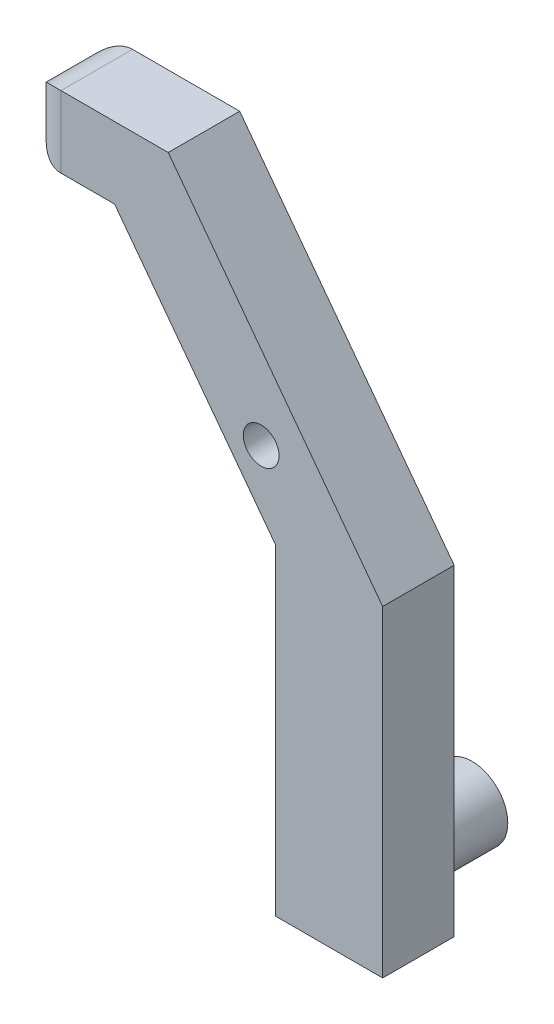
from build123d import *

# Parameters (mm, degrees)
EXTRUDE_1_DEPTH        = 20
FILLET_2_R             = 10
EXTRUDE_2_DEPTH        = 20
SKETCH_6_R             = 5
CUT_EXTRUDE_1_DEPTH    = 20
FILLET_2_OF_MIRROR_3_R = 10
SKETCH_8_W             = 30
SKETCH_8_H             = 20
CUT_EXTRUDE_2_DEPTH    = 215.941852602


with BuildPart() as part:
    # 草图4 → 凸台-拉伸1 (new body)
    with BuildSketch(Plane.XY):
        Polygon((0, 0), (-30, 0), (-30, 90), (30, 170), (70, 170), (70, 150), (45, 150), (0, 90), align=None)
    extrude_1 = extrude(amount=EXTRUDE_1_DEPTH)

    # 圆角2
    fillet_2_edges = [part.edges().sort_by_distance(p)[0] for p in [
        (70, 160, 0),
        (70, 170, 10),
        (70, 150, 10),
        (70, 160, 20),
    ]]
    fillet(fillet_2_edges, radius=FILLET_2_R - 0.0001)  # a hair under: the kernel refuses the full size

    # 草图5 → 凸台-拉伸2 (add)
    with BuildSketch(Plane(origin=(0, 0, 0), x_dir=(-1, 0, 0), z_dir=(0, 0, -1))):
        with BuildLine():
            ThreePointArc((7.928932188, 22.071067812), (5, 15), (7.928932188, 7.928932188))
            Line((7.928932188, 7.928932188), (15, 15))
            Line((15, 15), (7.928932188, 22.071067812))
        make_face()
        with BuildLine():
            Line((15, 15), (7.928932188, 7.928932188))
            ThreePointArc((7.928932188, 7.928932188), (15, 5), (22.071067812, 7.928932188))
            Line((22.071067812, 7.928932188), (15, 15))
        make_face()
        with BuildLine():
            Line((15, 15), (22.071067812, 7.928932188))
            ThreePointArc((22.071067812, 7.928932188), (24.238795325, 11.173165676), (25, 15))
            ThreePointArc((25, 15), (24.238795325, 18.826834324), (22.071067812, 22.071067812))
            Line((22.071067812, 22.071067812), (15, 15))
        make_face()
        with BuildLine():
            ThreePointArc((22.071067812, 22.071067812), (15, 25), (7.928932188, 22.071067812))
            Line((7.928932188, 22.071067812), (15, 15))
            Line((15, 15), (22.071067812, 22.071067812))
        make_face()
    extrude_2 = extrude(amount=EXTRUDE_2_DEPTH)

    # 草图6 → 切除-拉伸1 (cut)
    with BuildSketch(Plane.XY.offset(20)):
        with Locations((4, 112)):
            Circle(SKETCH_6_R)
    cut_extrude_1 = extrude(amount=-CUT_EXTRUDE_1_DEPTH, mode=Mode.SUBTRACT)

    # 镜向3: 凸台-拉伸1, 凸台-拉伸2, 切除-拉伸1 across plane
    add(extrude_1.mirror(Plane(origin=(-30, 0, 20), x_dir=(0, 0, 1), z_dir=(1, 0, 0))))
    add(extrude_2.mirror(Plane(origin=(-30, 0, 20), x_dir=(0, 0, 1), z_dir=(1, 0, 0))))
    add(cut_extrude_1.mirror(Plane(origin=(-30, 0, 20), x_dir=(0, 0, 1), z_dir=(1, 0, 0))), mode=Mode.SUBTRACT)

    # 圆角2 of 镜向3
    fillet_2_of_mirror_3_edges = [part.edges().sort_by_distance(p)[0] for p in [
        (-130, 160, 0),
        (-130, 170, 10),
        (-130, 150, 10),
        (-130, 160, 20),
    ]]
    fillet(fillet_2_of_mirror_3_edges, radius=FILLET_2_OF_MIRROR_3_R - 0.0001)  # a hair under: the kernel refuses the full size

    # 草图8 → 切除-拉伸2 (cut, through all)
    with BuildSketch(Plane.XZ):
        Polygon((88.976151269, 20), (0, 20), (0, 0), (-30, 0), (-30, -22.976425092), (88.976151269, -22.976425092), align=None)
        with Locations((-15, 10)):
            Rectangle(SKETCH_8_W, SKETCH_8_H)
    extrude(amount=-CUT_EXTRUDE_2_DEPTH, mode=Mode.SUBTRACT)


solid = part.part
